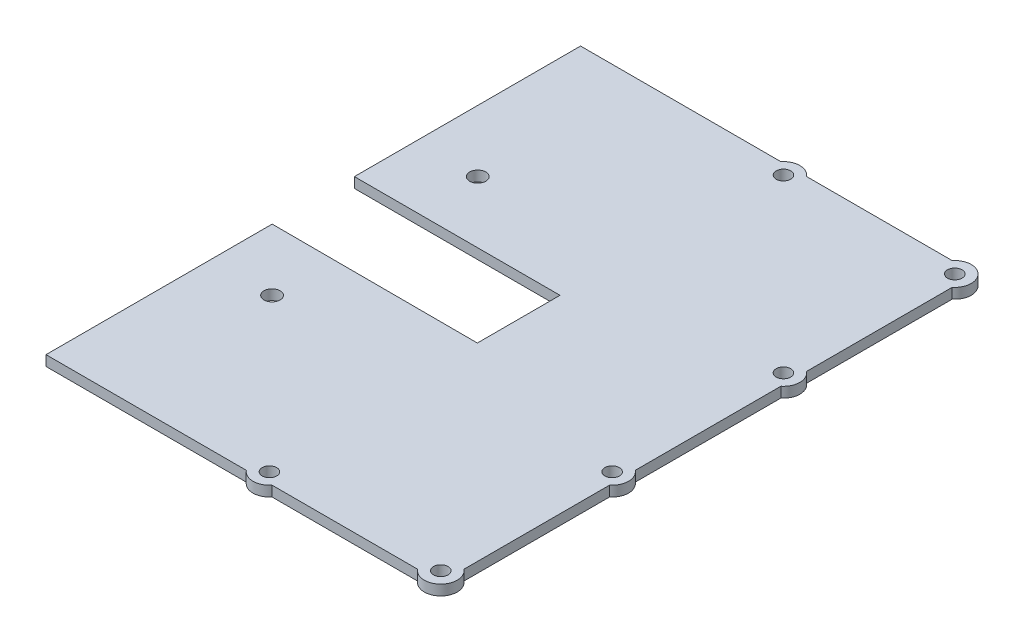
from build123d import *

# Parameters (mm, degrees)
SKETCH1_R           = 2.2479
BOSS_EXTRUDE1_DEPTH = 3.175
SKETCH2_R           = 2.4892
CUT_EXTRUDE1_DEPTH  = 208.933382


with BuildPart() as part:
    # Sketch1 → Boss-Extrude1 (new body)
    with BuildSketch(Plane(origin=(0, 0, 0), x_dir=(1, 0, 0), z_dir=(0, 1, 0))):
        with BuildLine():
            Line((0, 165.1), (61.874509804, 165.1))
            ThreePointArc((61.874509804, 165.1), (65.840083533, 167.005), (69.805657262, 165.1))
            Line((69.805657262, 165.1), (114.791176471, 165.1))
            ThreePointArc((114.791176471, 165.1), (122.348852648, 165.517102448), (121.9317502, 157.959426271))
            Line((121.9317502, 157.959426271), (121.9317502, 112.973907062))
            ThreePointArc((121.9317502, 112.973907062), (123.8367502, 109.008333333), (121.9317502, 105.042759604))
            Line((121.9317502, 105.042759604), (121.9317502, 60.057240396))
            ThreePointArc((121.9317502, 60.057240396), (123.8367502, 56.091666667), (121.9317502, 52.126092938))
            Line((121.9317502, 52.126092938), (121.9317502, 7.140573729))
            ThreePointArc((121.9317502, 7.140573729), (122.348852648, -0.417102448), (114.791176471, 0))
            Line((114.791176471, 0), (69.805657262, 0))
            ThreePointArc((69.805657262, 0), (65.840083533, -1.905), (61.874509804, 0))
            Line((61.874509804, 0), (0, 0))
            Line((0, 0), (0, 69.85))
            Line((0, 69.85), (63.5, 69.72449217))
            Line((63.5, 69.72449217), (63.5, 95.25))
            Line((63.5, 95.25), (0, 95.25))
            Line((0, 95.25), (0, 165.1))
        make_face()
        with Locations((65.840083533, 3.175)):
            Circle(SKETCH1_R, mode=Mode.SUBTRACT)
        with Locations((118.7567502, 3.175)):
            Circle(SKETCH1_R, mode=Mode.SUBTRACT)
        with Locations((118.7567502, 56.091666667)):
            Circle(SKETCH1_R, mode=Mode.SUBTRACT)
        with Locations((118.7567502, 109.008333333)):
            Circle(SKETCH1_R, mode=Mode.SUBTRACT)
        with Locations((118.7567502, 161.925)):
            Circle(SKETCH1_R, mode=Mode.SUBTRACT)
        with Locations((65.840083533, 161.925)):
            Circle(SKETCH1_R, mode=Mode.SUBTRACT)
    extrude(amount=BOSS_EXTRUDE1_DEPTH)

    # Sketch2 → Cut-Extrude1 (cut, through all)
    with BuildSketch(Plane.XZ):
        with Locations((19.05, -50.762310441)):
            Circle(SKETCH2_R)
        with Locations((19.05, -114.3)):
            Circle(SKETCH2_R)
    extrude(amount=-CUT_EXTRUDE1_DEPTH, mode=Mode.SUBTRACT)


solid = part.part
